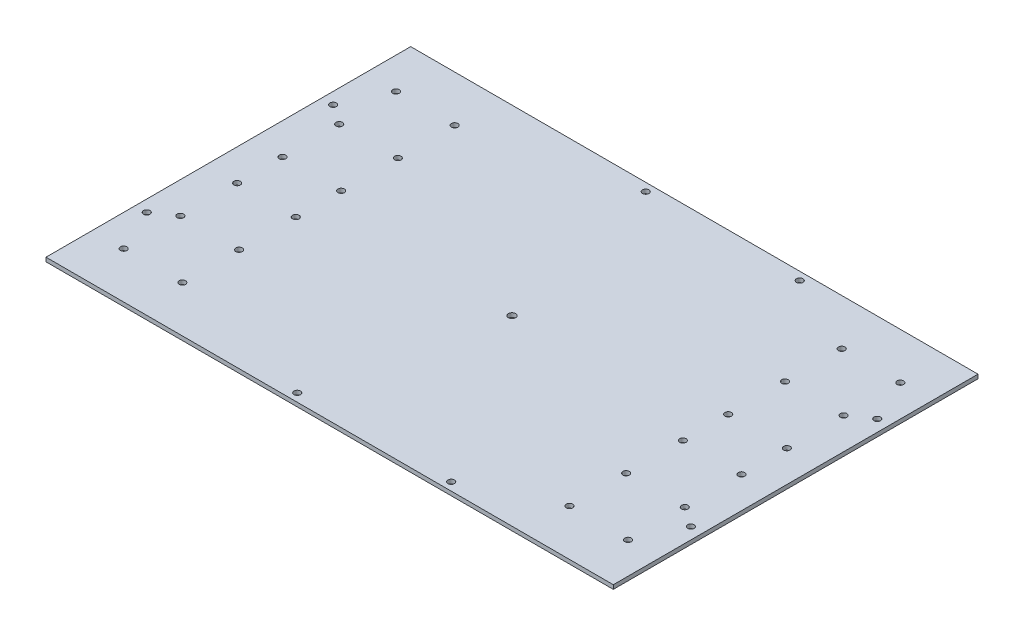
from build123d import *

# Parameters (mm, degrees)
SKETCH2_W               = 700
SKETCH2_H               = 450
BOSS_EXTRUDE1_DEPTH     = 2.5
SKETCH6_R               = 4
CUT_EXTRUDE2_DEPTH      = 417.112965431
CUT_EXTRUDE4_REACH      = 418.113
SKETCH8_R               = 4.5
SKETCH9_R               = 4
CUT_EXTRUDE5_DEPTH      = 417.112965431
CUT_EXTRUDE6_DEPTH      = 417.112965431
CUT_EXTRUDE6_DEPTH_BACK = 417.112965431
SKETCH10_R              = 4


with BuildPart() as part:
    # Sketch2 → Boss-Extrude1 (new, symmetric)
    with BuildSketch(Plane(origin=(0, 0, 0), x_dir=(1, 0, 0), z_dir=(0, 1, 0))):
        Rectangle(SKETCH2_W, SKETCH2_H)
    extrude(amount=BOSS_EXTRUDE1_DEPTH, both=True)

    # Sketch6 → Cut-Extrude2 (cut, through all)
    with BuildSketch(Plane(origin=(0, 2.5, 0), x_dir=(1, 0, 0), z_dir=(0, 1, 0))):
        with Locations((-311.203103448, 168)):
            Circle(SKETCH6_R)
        with Locations((-238.793103448, 168)):
            Circle(SKETCH6_R)
        with Locations((-238.793103448, 98)):
            Circle(SKETCH6_R)
        with Locations((-311.203103448, 98)):
            Circle(SKETCH6_R)
        with Locations((-311.203103448, 28)):
            Circle(SKETCH6_R)
        with Locations((-238.793103448, 28)):
            Circle(SKETCH6_R)
        with Locations((238.793103448, 168)):
            Circle(SKETCH6_R)
        with Locations((311.203103448, 168)):
            Circle(SKETCH6_R)
        with Locations((311.203103448, 98)):
            Circle(SKETCH6_R)
        with Locations((238.793103448, 98)):
            Circle(SKETCH6_R)
        with Locations((238.793103448, 28)):
            Circle(SKETCH6_R)
        with Locations((311.203103448, 28)):
            Circle(SKETCH6_R)
        with Locations((-311.203103448, -28)):
            Circle(SKETCH6_R)
        with Locations((-238.793103448, -28)):
            Circle(SKETCH6_R)
        with Locations((-238.793103448, -98)):
            Circle(SKETCH6_R)
        with Locations((-311.203103448, -98)):
            Circle(SKETCH6_R)
        with Locations((-311.203103448, -168)):
            Circle(SKETCH6_R)
        with Locations((-238.793103448, -168)):
            Circle(SKETCH6_R)
        with Locations((238.793103448, -28)):
            Circle(SKETCH6_R)
        with Locations((311.203103448, -28)):
            Circle(SKETCH6_R)
        with Locations((311.203103448, -98)):
            Circle(SKETCH6_R)
        with Locations((238.793103448, -98)):
            Circle(SKETCH6_R)
        with Locations((238.793103448, -168)):
            Circle(SKETCH6_R)
        with Locations((311.203103448, -168)):
            Circle(SKETCH6_R)
    extrude(amount=-CUT_EXTRUDE2_DEPTH, mode=Mode.SUBTRACT)

    # Sketch8 → Cut-Extrude4 (cut, up to next)
    with BuildSketch(Plane(origin=(0, 2.5, 0), x_dir=(1, 0, 0), z_dir=(0, 1, 0)), mode=Mode.PRIVATE) as cut_extrude4_sk1:
        Circle(SKETCH8_R)
    cut_extrude4_tool1 = extrude(cut_extrude4_sk1.sketch, amount=-CUT_EXTRUDE4_REACH, mode=Mode.PRIVATE) & part.part
    add(cut_extrude4_tool1.solids().sort_by_distance((0, 2.5, 0))[0], mode=Mode.SUBTRACT)

    # Sketch9 → Cut-Extrude5 (cut, through all)
    with BuildSketch(Plane(origin=(0, 2.5, 0), x_dir=(1, 0, 0), z_dir=(0, 1, 0))):
        with Locations((-50, -215)):
            Circle(SKETCH9_R)
        with Locations((140, -215)):
            Circle(SKETCH9_R)
        with Locations((-50, 215)):
            Circle(SKETCH9_R)
        with Locations((140, 215)):
            Circle(SKETCH9_R)
    extrude(amount=-CUT_EXTRUDE5_DEPTH, mode=Mode.SUBTRACT)

    # Sketch10 → Cut-Extrude6 (cut, two sides: drawn at the far end of the back side and taken through both)
    with BuildSketch(Plane(origin=(0, 2.5, 0), x_dir=(1, 0, 0), z_dir=(0, 1, 0)).offset(-CUT_EXTRUDE6_DEPTH_BACK)):
        with Locations((-335.68, 115)):
            Circle(SKETCH10_R)
        with Locations((-335.68, -115)):
            Circle(SKETCH10_R)
        with Locations((335.68, 115)):
            Circle(SKETCH10_R)
        with Locations((335.68, -115)):
            Circle(SKETCH10_R)
    extrude(amount=CUT_EXTRUDE6_DEPTH + CUT_EXTRUDE6_DEPTH_BACK, mode=Mode.SUBTRACT)


solid = part.part
